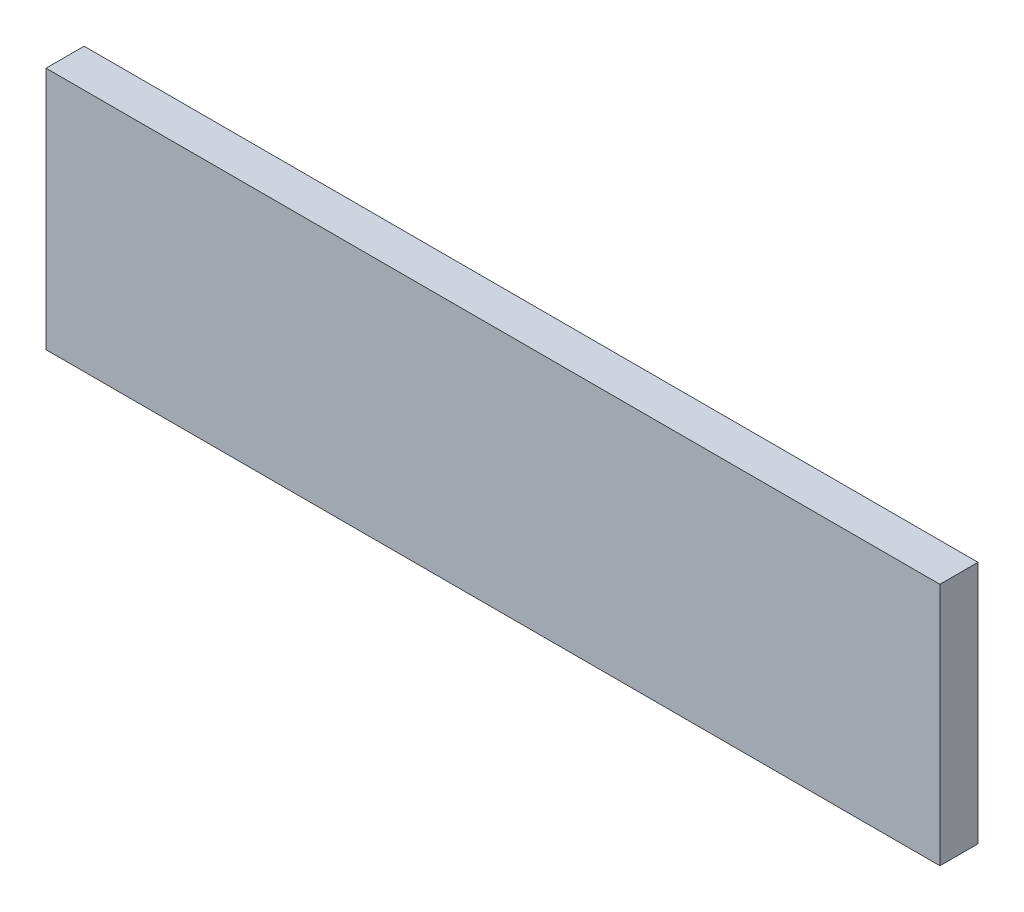
from build123d import *

# Parameters (mm, degrees)
SKETCH1_W           = 279.4
SKETCH1_H           = 76.2
BOSS_EXTRUDE1_DEPTH = 11.90625


with BuildPart() as part:
    # Sketch1 → Boss-Extrude1 (new body)
    with BuildSketch(Plane.XY):
        with Locations((78.460461957, 11.43)):
            Rectangle(SKETCH1_W, SKETCH1_H)
    extrude(amount=BOSS_EXTRUDE1_DEPTH)


solid = part.part
